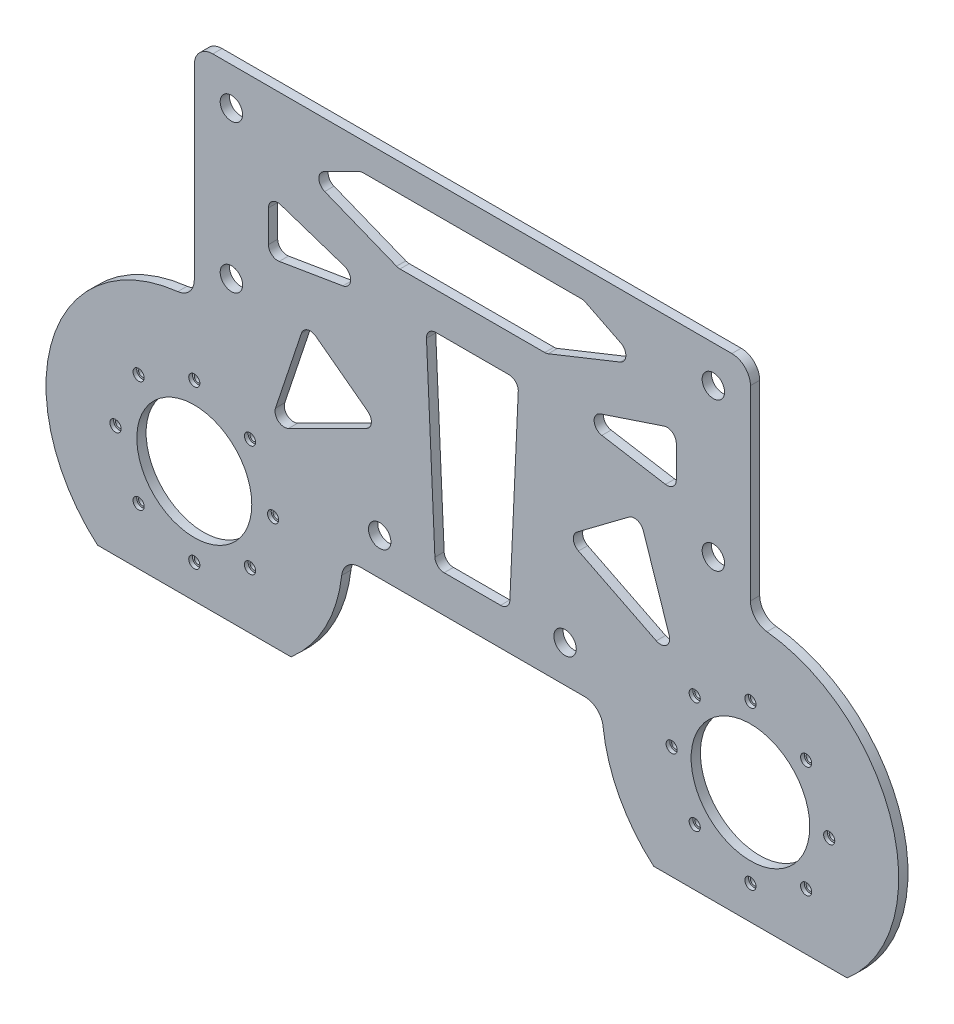
from build123d import *

# Parameters (mm, degrees)
EXTRUDE_1_OUTLINE_R   = 2
EXTRUDE_1_OUTLINE_R_2 = 6.05
EXTRUDE_1_DEPTH       = 5
CUT_EXTRUDE_START     = -2
SKETCH_2_R            = 3
SKETCH_2_R_2          = 2
CUT_EXTRUDE_1_DEPTH   = 2
SKETCH_3_R            = 31
SKETCH_3_R_2          = 32
CUT_EXTRUDE_2_DEPTH   = 281.579587951
FILLET_1_R            = 10
SKETCH1_R             = 11.937888281
CUT_EXTRUDE1_DEPTH    = 10
FILLET1_R             = 5


# Read off the part's stored shape, not the designer's step: 凸台-拉伸1
with BuildPart() as part:
    # 凸台-拉伸1 outline → 凸台-拉伸1 (new body)
    with BuildSketch(Plane.XY):
        with BuildLine():
            ThreePointArc((-97.800454043, -160.623488863), (-77.281489026, -133.346936317), (-70, -100))
            Line((-70, -100), (70, -100))
            ThreePointArc((70, -100), (77.281489026, -133.346936317), (97.800454043, -160.623488863))
            Line((97.800454043, -160.623488863), (202.199545957, -160.623488863))
            ThreePointArc((202.199545957, -160.623488863), (224.999597029, -72.160092574), (150, -20))
            Line((150, -20), (150, 100))
            Line((150, 100), (-150, 100))
            Line((-150, 100), (-150, -20))
            ThreePointArc((-150, -20), (-224.999597029, -72.160092574), (-202.199545957, -160.623488863))
            Line((-202.199545957, -160.623488863), (-97.800454043, -160.623488863))
        make_face()
        with Locations((-180.0520382, -130.0520382)):
            Circle(EXTRUDE_1_OUTLINE_R, mode=Mode.SUBTRACT)
        with Locations((-150, -142.5)):
            Circle(EXTRUDE_1_OUTLINE_R, mode=Mode.SUBTRACT)
        with Locations((-119.9479618, -130.0520382)):
            Circle(EXTRUDE_1_OUTLINE_R, mode=Mode.SUBTRACT)
        with Locations((-192.5, -100)):
            Circle(EXTRUDE_1_OUTLINE_R, mode=Mode.SUBTRACT)
        with Locations((-107.5, -100)):
            Circle(EXTRUDE_1_OUTLINE_R, mode=Mode.SUBTRACT)
        with Locations((-180.0520382, -69.9479618)):
            Circle(EXTRUDE_1_OUTLINE_R, mode=Mode.SUBTRACT)
        with Locations((-119.9479618, -69.9479618)):
            Circle(EXTRUDE_1_OUTLINE_R, mode=Mode.SUBTRACT)
        with Locations((-150, -57.5)):
            Circle(EXTRUDE_1_OUTLINE_R, mode=Mode.SUBTRACT)
        with Locations((-50, -80)):
            Circle(EXTRUDE_1_OUTLINE_R_2, mode=Mode.SUBTRACT)
        with Locations((107.5, -100)):
            Circle(EXTRUDE_1_OUTLINE_R, mode=Mode.SUBTRACT)
        with Locations((119.9479618, -130.0520382)):
            Circle(EXTRUDE_1_OUTLINE_R, mode=Mode.SUBTRACT)
        with Locations((150, -142.5)):
            Circle(EXTRUDE_1_OUTLINE_R, mode=Mode.SUBTRACT)
        with Locations((180.0520382, -130.0520382)):
            Circle(EXTRUDE_1_OUTLINE_R, mode=Mode.SUBTRACT)
        with Locations((192.5, -100)):
            Circle(EXTRUDE_1_OUTLINE_R, mode=Mode.SUBTRACT)
        with Locations((50, -80)):
            Circle(EXTRUDE_1_OUTLINE_R_2, mode=Mode.SUBTRACT)
        with Locations((119.9479618, -69.9479618)):
            Circle(EXTRUDE_1_OUTLINE_R, mode=Mode.SUBTRACT)
        with Locations((180.0520382, -69.9479618)):
            Circle(EXTRUDE_1_OUTLINE_R, mode=Mode.SUBTRACT)
        with Locations((150, -57.5)):
            Circle(EXTRUDE_1_OUTLINE_R, mode=Mode.SUBTRACT)
        with Locations((-130, 0)):
            Circle(EXTRUDE_1_OUTLINE_R_2, mode=Mode.SUBTRACT)
        with Locations((-130, 79.62392947)):
            Circle(EXTRUDE_1_OUTLINE_R_2, mode=Mode.SUBTRACT)
        with Locations((130, 0)):
            Circle(EXTRUDE_1_OUTLINE_R_2, mode=Mode.SUBTRACT)
        with Locations((130, 80)):
            Circle(EXTRUDE_1_OUTLINE_R_2, mode=Mode.SUBTRACT)
    extrude(amount=EXTRUDE_1_DEPTH)

    # 草图2 → 切除-拉伸1 (cut)
    # profile 1 of 16: a face of its own
    with BuildSketch(Plane.XY.offset(5).offset(CUT_EXTRUDE_START)):
        with Locations((-192.5, -100)):
            Circle(SKETCH_2_R)
        with Locations((-192.5, -100)):
            Circle(SKETCH_2_R_2, mode=Mode.SUBTRACT)
    # profile 2 of 16: a face of its own
    with BuildSketch(Plane.XY.offset(5).offset(CUT_EXTRUDE_START)):
        with Locations((-180.0520382, -130.0520382)):
            Circle(SKETCH_2_R)
        with Locations((-180.0520382, -130.0520382)):
            Circle(SKETCH_2_R_2, mode=Mode.SUBTRACT)
    # profile 3 of 16: a face of its own
    with BuildSketch(Plane.XY.offset(5).offset(CUT_EXTRUDE_START)):
        with Locations((-150, -142.5)):
            Circle(SKETCH_2_R)
        with Locations((-150, -142.5)):
            Circle(SKETCH_2_R_2, mode=Mode.SUBTRACT)
    # profile 4 of 16: a face of its own
    with BuildSketch(Plane.XY.offset(5).offset(CUT_EXTRUDE_START)):
        with Locations((-119.9479618, -130.0520382)):
            Circle(SKETCH_2_R)
        with Locations((-119.9479618, -130.0520382)):
            Circle(SKETCH_2_R_2, mode=Mode.SUBTRACT)
    # profile 5 of 16: a face of its own
    with BuildSketch(Plane.XY.offset(5).offset(CUT_EXTRUDE_START)):
        with Locations((-107.5, -100)):
            Circle(SKETCH_2_R)
        with Locations((-107.5, -100)):
            Circle(SKETCH_2_R_2, mode=Mode.SUBTRACT)
    # profile 6 of 16: a face of its own
    with BuildSketch(Plane.XY.offset(5).offset(CUT_EXTRUDE_START)):
        with Locations((150, -57.5)):
            Circle(SKETCH_2_R)
        with Locations((150, -57.5)):
            Circle(SKETCH_2_R_2, mode=Mode.SUBTRACT)
    # profile 7 of 16: a face of its own
    with BuildSketch(Plane.XY.offset(5).offset(CUT_EXTRUDE_START)):
        with Locations((180.0520382, -69.9479618)):
            Circle(SKETCH_2_R)
        with Locations((180.0520382, -69.9479618)):
            Circle(SKETCH_2_R_2, mode=Mode.SUBTRACT)
    # profile 8 of 16: a face of its own
    with BuildSketch(Plane.XY.offset(5).offset(CUT_EXTRUDE_START)):
        with Locations((119.9479618, -69.9479618)):
            Circle(SKETCH_2_R)
        with Locations((119.9479618, -69.9479618)):
            Circle(SKETCH_2_R_2, mode=Mode.SUBTRACT)
    # profile 9 of 16: a face of its own
    with BuildSketch(Plane.XY.offset(5).offset(CUT_EXTRUDE_START)):
        with Locations((107.5, -100)):
            Circle(SKETCH_2_R)
        with Locations((107.5, -100)):
            Circle(SKETCH_2_R_2, mode=Mode.SUBTRACT)
    # profile 10 of 16: a face of its own
    with BuildSketch(Plane.XY.offset(5).offset(CUT_EXTRUDE_START)):
        with Locations((150, -142.5)):
            Circle(SKETCH_2_R)
        with Locations((150, -142.5)):
            Circle(SKETCH_2_R_2, mode=Mode.SUBTRACT)
    # profile 11 of 16: a face of its own
    with BuildSketch(Plane.XY.offset(5).offset(CUT_EXTRUDE_START)):
        with Locations((180.0520382, -130.0520382)):
            Circle(SKETCH_2_R)
        with Locations((180.0520382, -130.0520382)):
            Circle(SKETCH_2_R_2, mode=Mode.SUBTRACT)
    # profile 12 of 16: a face of its own
    with BuildSketch(Plane.XY.offset(5).offset(CUT_EXTRUDE_START)):
        with Locations((-150, -57.5)):
            Circle(SKETCH_2_R)
    # profile 13 of 16: a face of its own
    with BuildSketch(Plane.XY.offset(5).offset(CUT_EXTRUDE_START)):
        with Locations((-119.9479618, -69.9479618)):
            Circle(SKETCH_2_R)
    # profile 14 of 16: a face of its own
    with BuildSketch(Plane.XY.offset(5).offset(CUT_EXTRUDE_START)):
        with Locations((-180.0520382, -69.9479618)):
            Circle(SKETCH_2_R)
    # profile 15 of 16: a face of its own
    with BuildSketch(Plane.XY.offset(5).offset(CUT_EXTRUDE_START)):
        with Locations((119.9479618, -130.0520382)):
            Circle(SKETCH_2_R)
    # profile 16 of 16: a face of its own
    with BuildSketch(Plane.XY.offset(5).offset(CUT_EXTRUDE_START)):
        with Locations((192.5, -100)):
            Circle(SKETCH_2_R)
    extrude(amount=CUT_EXTRUDE_1_DEPTH, mode=Mode.SUBTRACT)

    # 草图3 → 切除-拉伸2 (cut, through all)
    with BuildSketch(Plane.XY.offset(5)):
        with Locations((-150, -100)):
            Circle(SKETCH_3_R)
        with Locations((150, -100)):
            Circle(SKETCH_3_R_2)
    extrude(amount=-CUT_EXTRUDE_2_DEPTH, mode=Mode.SUBTRACT)

    # 圆角1
    fillet_1_edges = [part.edges().sort_by_distance(p)[0] for p in [
        (-150, -20, 2.5),
        (-150, 100, 2.5),
        (150, 100, 2.5),
        (150, -20, 2.5),
        (70, -100, 2.5),
        (-70, -100, 2.5),
    ]]
    fillet(fillet_1_edges, radius=FILLET_1_R)

    # Sketch1 → Cut-Extrude1 (cut)
    # profile 1 of 6: a face of its own
    with BuildSketch(Plane.XY.offset(5)):
        Polygon((-90, 70), (-40, 50), (40, 50), (90, 70), (60, 85), (-60, 85), align=None)
    # profile 2 of 6: a face of its own
    with BuildSketch(Plane.XY.offset(5)):
        Polygon((-110, 50), (-110, 20), (-50, 30), align=None)
    # profile 3 of 6: a face of its own
    with BuildSketch(Plane.XY.offset(5)):
        Polygon((50, 30), (110, 20), (110, 50), align=None)
    # profile 4 of 6: a face of its own
    with BuildSketch(Plane.XY.offset(5)):
        Polygon((-25, 30), (25, 30), (20, -80), (-20, -80), align=None)
        Circle(SKETCH1_R, mode=Mode.SUBTRACT)
    # profile 5 of 6: a face of its own
    with BuildSketch(Plane.XY.offset(5)):
        Polygon((-90, 0), (-50, -30), (-110, -60), align=None)
    # profile 6 of 6: a face of its own
    with BuildSketch(Plane.XY.offset(5)):
        Polygon((50, -30), (90, 0), (110, -60), align=None)
    extrude(amount=-CUT_EXTRUDE1_DEPTH, mode=Mode.SUBTRACT)


with BuildPart() as body_2:
    # of the pieces the cut leaves, the one that is kept (cut_extrude1_keep)
    add(part.part.solids().sort_by_distance((-158.888888889, -20.4953608, 0))[0])

    # Fillet1
    fillet1_edges = [body_2.edges().sort_by_distance(p)[0] for p in [
        (-60, 85, 2.5),
        (60, 85, 2.5),
        (90, 70, 2.5),
        (40, 50, 2.5),
        (-40, 50, 2.5),
        (-90, 70, 2.5),
        (50, -30, 2.5),
        (90, 0, 2.5),
        (110, -60, 2.5),
        (-25, 30, 2.5),
        (25, 30, 2.5),
        (20, -80, 2.5),
        (-20, -80, 2.5),
        (-50, 30, 2.5),
        (-110, 20, 2.5),
        (-110, 50, 2.5),
        (110, 50, 2.5),
        (110, 20, 2.5),
        (50, 30, 2.5),
        (-90, 0, 2.5),
        (-50, -30, 2.5),
        (-110, -60, 2.5),
    ]]
    fillet(fillet1_edges, radius=FILLET1_R)


solid = body_2.part
